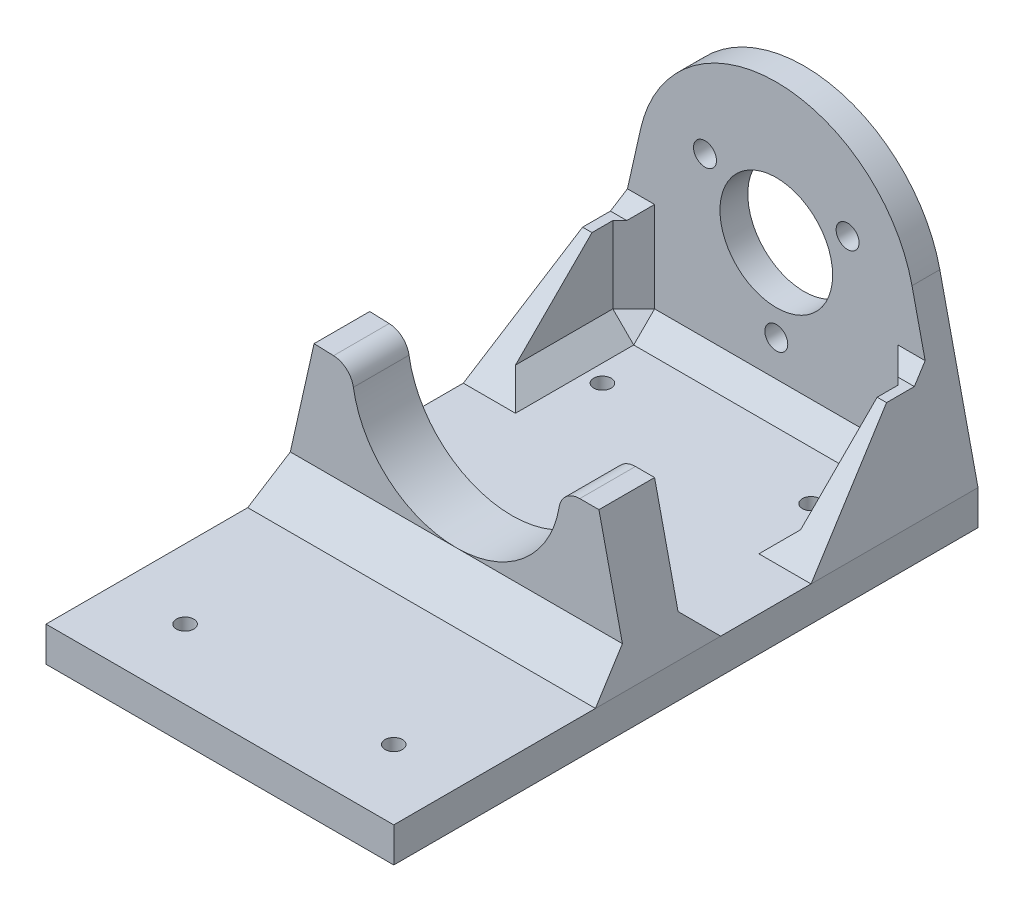
from build123d import *

# Parameters (mm, degrees)
ESQUISSE1_R                  = 8.1
ESQUISSE1_R_2                = 1.65
BOSS_EXTRU_1_DEPTH           = 4
ESQUISSE2_W                  = 50
ESQUISSE2_H                  = 5
BOSS_EXTRU_2_DEPTH           = 80
BOSS_EXTRU_3_DEPTH           = 20
ENL_V_MAT_EXTRU_2_DEPTH      = 99.748417709
ENL_V_MAT_EXTRU_2_DEPTH_BACK = 99.748417709
CHANFREIN1_SIZE              = 3
CHANFREIN2_SIZE              = 2
BOSS_EXTRU_4_DEPTH           = 4
BOSS_EXTRU_4_DEPTH_BACK      = 4
CHANFREIN3_SIZE              = 5
ENL_V_MAT_EXTRU_3_DEPTH      = 5
ENL_V_MAT_EXTRU_3_DEPTH_BACK = 20
ESQUISSE6_R                  = 1.25
CONG_1_R                     = 3


with BuildPart() as part:
    # Esquisse1 → Boss.-Extru.1 (new body)
    with BuildSketch(Plane.XY):
        with BuildLine():
            Line((-25, -20), (-25, -25))
            Line((-25, -25), (25, -25))
            Line((25, -25), (25, -20))
            Line((25, -20), (19.512195122, 4.390243902))
            ThreePointArc((19.512195122, 4.390243902), (0, 20), (-19.512195122, 4.390243902))
            Line((-19.512195122, 4.390243902), (-25, -20))
        make_face()
        Circle(ESQUISSE1_R, mode=Mode.SUBTRACT)
        with Locations((-10.25, 5.917840259)):
            Circle(ESQUISSE1_R_2, mode=Mode.SUBTRACT)
        with Locations((10.25, 5.917840259)):
            Circle(ESQUISSE1_R_2, mode=Mode.SUBTRACT)
        with Locations((0, -11.835680518)):
            Circle(ESQUISSE1_R_2, mode=Mode.SUBTRACT)
    extrude(amount=BOSS_EXTRU_1_DEPTH)

    # Esquisse2 → Boss.-Extru.2 (add)
    with BuildSketch(Plane.XY.offset(4)):
        with Locations((0, -22.5)):
            Rectangle(ESQUISSE2_W, ESQUISSE2_H)
    extrude(amount=BOSS_EXTRU_2_DEPTH)

    # Esquisse4 → Boss.-Extru.3 (add)
    with BuildSketch(Plane.XY.offset(4)):
        Polygon((-20.5, 0), (-20.5, -20), (-25, -20), align=None)
        Polygon((20.5, -20), (25, -20), (20.5, 0), align=None)
    extrude(amount=BOSS_EXTRU_3_DEPTH)

    # Esquisse5 → Enlèv. mat.-Extru.2 (cut, two sides: drawn at the far end of the back side and taken through both)
    with BuildSketch(Plane(origin=(-20.5, 0, 0), x_dir=(0, 0, -1), z_dir=(1, 0, 0)).offset(-ENL_V_MAT_EXTRU_2_DEPTH_BACK)):
        Polygon((-4, 0), (-24, 0), (-24, -20), (-10, -6), (-4, -6), align=None)
    extrude(amount=ENL_V_MAT_EXTRU_2_DEPTH + ENL_V_MAT_EXTRU_2_DEPTH_BACK, mode=Mode.SUBTRACT)

    # Chanfrein1
    chanfrein1_edges = [part.edges().sort_by_distance(p)[0] for p in [
        (-20.5, -13, 4),
        (-20.5, -20, 14),
        (0, -20, 4),
        (20.5, -20, 14),
        (20.5, -13, 4),
    ]]
    chamfer(chanfrein1_edges, length=CHANFREIN1_SIZE)

    # Chanfrein2
    chanfrein2_edges = [part.edges().sort_by_distance(p)[0] for p in [
        (-19.675, -6, 4),
        (19.675, -6, 4),
    ]]
    chamfer(chanfrein2_edges, length=CHANFREIN2_SIZE)

    # Esquisse7 → Boss.-Extru.4 (add, two sides: drawn at the far end of the back side and taken through both)
    with BuildSketch(Plane.XY.offset(46).offset(-BOSS_EXTRU_4_DEPTH_BACK)):
        with BuildLine():
            Line((-15, 0), (-20.456097561, 0.195121951))
            Line((-20.456097561, 0.195121951), (-25, -20))
            Line((-25, -20), (25, -20))
            Line((25, -20), (20.5, 0))
            Line((20.5, 0), (15, 0))
            ThreePointArc((15, 0), (0, -15), (-15, 0))
        make_face()
    extrude(amount=BOSS_EXTRU_4_DEPTH + BOSS_EXTRU_4_DEPTH_BACK)

    # Chanfrein3
    # the kernel refuses this chamfer: 5 mm, written as the material it adds along each edge
    with BuildSketch(Plane(origin=(-25, -20, 42), x_dir=(0, -0.027495876610586317, -0.9996219169112968), z_dir=(1, 0, 0))) as chanfrein3_piece_1_section:
        Polygon((CHANFREIN3_SIZE * 0.999621916911, CHANFREIN3_SIZE * 0.0274958766106), (-CHANFREIN3_SIZE * 0.0274958766106, CHANFREIN3_SIZE * 0.999621916911), (0, 0), align=None)
    chanfrein3_piece_1 = extrude(amount=50, mode=Mode.PRIVATE)
    chanfrein3_piece_1 = split(chanfrein3_piece_1, bisect_by=Plane(origin=(23.445378938, -13.090573058, 40.343175913), z_dir=(-0.9756097560975611, -0.2195121951219509, 0)), keep=Keep.TOP, mode=Mode.PRIVATE)
    chanfrein3_piece_1 = split(chanfrein3_piece_1, bisect_by=Plane(origin=(-23.445378938, -13.090573058, 40.343175913), z_dir=(0.9756097560975611, -0.21951219512195103, 0)), keep=Keep.TOP, mode=Mode.PRIVATE)
    chanfrein3_piece_1 = chanfrein3_piece_1 - Plane(origin=(0, 0, 40.343175913), x_dir=(1, 0, 0), z_dir=(0, 0, -1)) * Cylinder(15, 120, mode=Mode.PRIVATE)
    add(chanfrein3_piece_1)
    with BuildSketch(Plane(origin=(-25, -20, 50), x_dir=(0, -0.027495876610586317, 0.9996219169112968), z_dir=(1, 0, 0))) as chanfrein3_piece_2_section:
        Polygon((CHANFREIN3_SIZE * 0.999621916911, -CHANFREIN3_SIZE * 0.0274958766106), (-CHANFREIN3_SIZE * 0.0274958766106, -CHANFREIN3_SIZE * 0.999621916911), (0, 0), align=None)
    chanfrein3_piece_2 = extrude(amount=50, mode=Mode.PRIVATE)
    chanfrein3_piece_2 = split(chanfrein3_piece_2, bisect_by=Plane(origin=(23.445378938, -13.090573058, 51.656824087), z_dir=(-0.9756097560975611, -0.2195121951219509, 0)), keep=Keep.TOP, mode=Mode.PRIVATE)
    chanfrein3_piece_2 = split(chanfrein3_piece_2, bisect_by=Plane(origin=(-23.445378938, -13.090573058, 51.656824087), z_dir=(0.9756097560975611, -0.21951219512195103, 0)), keep=Keep.TOP, mode=Mode.PRIVATE)
    chanfrein3_piece_2 = chanfrein3_piece_2 - Plane(origin=(0, 0, 51.656824087), x_dir=(1, 0, 0), z_dir=(0, 0, -1)) * Cylinder(15, 120, mode=Mode.PRIVATE)
    add(chanfrein3_piece_2)

    # Esquisse6 → Enlèv. mat.-Extru.3 (cut, two sides: drawn at the far end of the back side and taken through both)
    with BuildSketch(Plane(origin=(0, -20, 0), x_dir=(1, 0, 0), z_dir=(0, 1, 0)).offset(-ENL_V_MAT_EXTRU_3_DEPTH_BACK)):
        with Locations(Location((-15, -74, 0), (0, 0, 90))):
            Circle(ESQUISSE6_R)
        with Locations(Location((15, -74, 0), (0, 0, 90))):
            Circle(ESQUISSE6_R)
        with Locations(Location((15, -14, 0), (0, 0, 90))):
            Circle(ESQUISSE6_R)
        with Locations(Location((-15, -14, 0), (0, 0, 90))):
            Circle(ESQUISSE6_R)
        with Locations(Location((-15, -44, 0), (0, 0, 270))):
            Circle(ESQUISSE6_R)
        with Locations(Location((15, -44, 0), (0, 0, 90))):
            Circle(ESQUISSE6_R)
    extrude(amount=ENL_V_MAT_EXTRU_3_DEPTH + ENL_V_MAT_EXTRU_3_DEPTH_BACK, mode=Mode.SUBTRACT)

    # Congé1
    cong_1_edges = [part.edges().sort_by_distance(p)[0] for p in [
        (-15, 0, 46),
        (15, 0, 46),
    ]]
    fillet(cong_1_edges, radius=CONG_1_R)


solid = part.part
